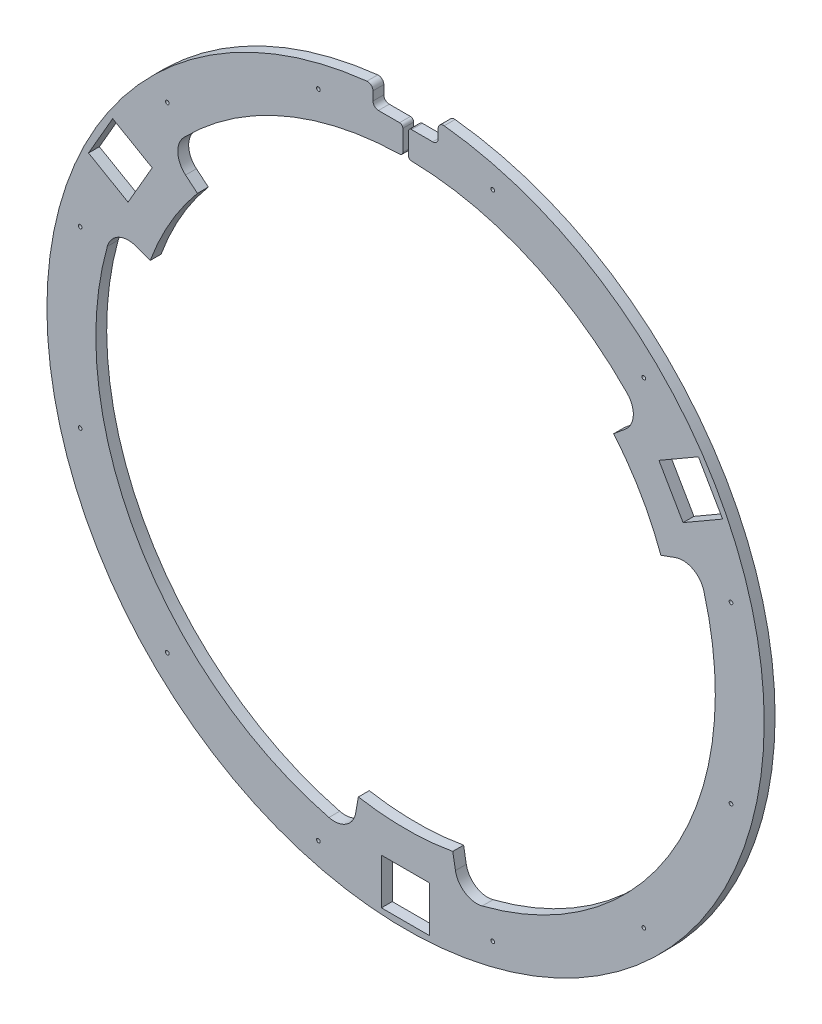
from build123d import *

# Parameters (mm, degrees)
SKETCH2_R                                       = 330
SKETCH2_R_2                                     = 250
SKETCH2_W                                       = 44.45
SKETCH2_H                                       = 42
BOSS_EXTRUDE1_DEPTH                             = 10
CUT_EXTRUDE1_START                              = -10
CUT_EXTRUDE1_DEPTH                              = 10
SKETCH5_W                                       = 60
SKETCH5_H                                       = 60
CUT_EXTRUDE2_DEPTH                              = 10
FILLET1_R                                       = 5
SKETCH6_W                                       = 5
SKETCH6_H                                       = 30
CUT_EXTRUDE3_DEPTH                              = 10
FILLET2_R                                       = 3
CSK_FOR_M3_FLAT_HEAD_MACHINE_SCREW1_D           = 3.4
CSK_FOR_M3_FLAT_HEAD_MACHINE_SCREW1_CSINK_D     = 6.3
CSK_FOR_M3_FLAT_HEAD_MACHINE_SCREW1_CSINK_ANGLE = 90


with BuildPart() as part:
    # Sketch2 → Boss-Extrude1 (new body)
    with BuildSketch(Plane.XY.offset(-520.360637908)):
        Circle(SKETCH2_R)
        Circle(SKETCH2_R_2, mode=Mode.SUBTRACT)
        with Locations((0, -303)):
            Rectangle(SKETCH2_W, SKETCH2_H, mode=Mode.SUBTRACT)
        Polygon((269.479730826, 181.247414599), (233.106663867, 160.247414599), (255.331663867, 121.752585401), (291.704730826, 142.752585401), align=None, mode=Mode.SUBTRACT)
        Polygon((-291.704730826, 142.752585401), (-255.331663867, 121.752585401), (-233.106663867, 160.247414599), (-269.479730826, 181.247414599), align=None, mode=Mode.SUBTRACT)
    extrude(amount=BOSS_EXTRUDE1_DEPTH)

    # Sketch3 → Cut-Extrude1 (cut)
    with BuildSketch(Plane.XY.offset(-510.360637908).offset(CUT_EXTRUDE1_START)):
        with BuildLine():
            Line((191.51111078, 160.696902422), (202.422805046, 169.852901056))
            ThreePointArc((202.422805046, 169.852901056), (209.542560602, 184.184300077), (203.874000238, 199.14917029))
            ThreePointArc((203.874000238, 199.14917029), (0, 285), (-203.874000238, 199.14917029))
            ThreePointArc((-203.874000238, 199.14917029), (-209.542560602, 184.184300077), (-202.422805046, 169.852901056))
            Line((-202.422805046, 169.852901056), (-191.51111078, 160.696902422))
            ThreePointArc((-191.51111078, 160.696902422), (0, 250), (191.51111078, 160.696902422))
        make_face()
        with BuildLine():
            Line((43.412044417, -246.201938253), (45.885524698, -260.229742003))
            ThreePointArc((45.885524698, -260.229742003), (54.737002544, -273.561330694), (70.531240495, -276.134648522))
            ThreePointArc((70.531240495, -276.134648522), (246.817240079, -142.5), (274.405240732, 76.985478232))
            ThreePointArc((274.405240732, 76.985478232), (264.279563146, 89.377030617), (248.308329744, 90.376840947))
            Line((248.308329744, 90.376840947), (234.923155196, 85.505035831))
            ThreePointArc((234.923155196, 85.505035831), (216.506350946, -125), (43.412044417, -246.201938253))
        make_face()
        with BuildLine():
            Line((-234.923155196, 85.505035831), (-248.308329744, 90.376840947))
            ThreePointArc((-248.308329744, 90.376840947), (-264.279563146, 89.377030617), (-274.405240732, 76.985478232))
            ThreePointArc((-274.405240732, 76.985478232), (-246.817240079, -142.5), (-70.531240495, -276.134648522))
            ThreePointArc((-70.531240495, -276.134648522), (-54.737002544, -273.561330694), (-45.885524698, -260.229742003))
            Line((-45.885524698, -260.229742003), (-43.412044417, -246.201938253))
            ThreePointArc((-43.412044417, -246.201938253), (-216.506350946, -125), (-234.923155196, 85.505035831))
        make_face()
    extrude(amount=CUT_EXTRUDE1_DEPTH, mode=Mode.SUBTRACT)

    # Sketch5 → Cut-Extrude2 (cut)
    with BuildSketch(Plane.XY.offset(-510.360637908)):
        with Locations((0, 340)):
            Rectangle(SKETCH5_W, SKETCH5_H)
    extrude(amount=-CUT_EXTRUDE2_DEPTH, mode=Mode.SUBTRACT)

    # Fillet1
    fillet1_edges = [part.edges().sort_by_distance(p)[0] for p in [
        (30, 310, -515.360637908),
        (30, 328.633534503, -515.360637908),
        (-30, 328.633534503, -515.360637908),
        (-30, 310, -515.360637908),
    ]]
    fillet(fillet1_edges, radius=FILLET1_R)

    # Sketch6 → Cut-Extrude3 (cut)
    with BuildSketch(Plane.XY.offset(-510.360637908)):
        with Locations((0, 295)):
            Rectangle(SKETCH6_W, SKETCH6_H)
    extrude(amount=-CUT_EXTRUDE3_DEPTH, mode=Mode.SUBTRACT)

    # Fillet2
    fillet2_edges = [part.edges().sort_by_distance(p)[0] for p in [
        (-2.5, 310, -515.360637908),
        (2.5, 310, -515.360637908),
        (-2.5, 284.989034877, -515.360637908),
        (2.5, 284.989034877, -515.360637908),
    ]]
    fillet(fillet2_edges, radius=FILLET2_R)

    # CSK for M3 Flat Head Machine Screw1 (through all)
    with Locations(Plane(origin=(0, 0, -530.360637908), x_dir=(1, 0, 0), z_dir=(0, 0, -1))):
        with Locations((80.233903982, 299.43700615), (219.203102168, 219.203102168), (299.43700615, 80.233903982), (299.43700615, -80.233903982), (219.203102168, -219.203102168), (80.233903982, -299.43700615), (-80.233903982, -299.43700615), (-219.203102168, -219.203102168), (-299.43700615, -80.233903982), (-299.43700615, 80.233903982), (-219.203102168, 219.203102168), (-80.233903982, 299.43700615), (0, 0)):
            CounterSinkHole(CSK_FOR_M3_FLAT_HEAD_MACHINE_SCREW1_D / 2, CSK_FOR_M3_FLAT_HEAD_MACHINE_SCREW1_CSINK_D / 2, counter_sink_angle=CSK_FOR_M3_FLAT_HEAD_MACHINE_SCREW1_CSINK_ANGLE)


solid = part.part
